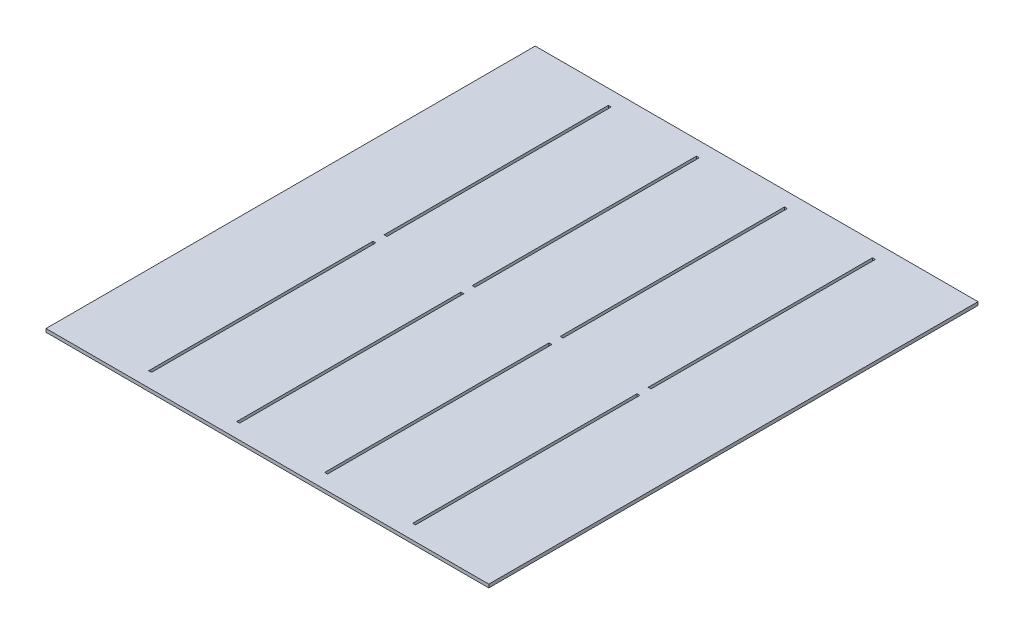
from build123d import *

# Parameters (mm, degrees)
SKETCH1_W          = 434.8
SKETCH1_H          = 480.4
SKETCH1_W_2        = 2.7888
SKETCH1_H_2        = 220.2
BASE_FLANGE2_DEPTH = 3.264


# Sheet-metal steps are written as plain solids
with BuildPart() as part:
    # Sketch1 → Base-Flange2 (new body)
    with BuildSketch(Plane(origin=(0, 0, 0), x_dir=(1, 0, 0), z_dir=(0, 1, 0))):
        with Locations((217.4, 240.2)):
            Rectangle(SKETCH1_W, SKETCH1_H)
        with Locations((87.74, 355.8112)):
            Rectangle(SKETCH1_W_2, SKETCH1_H_2, mode=Mode.SUBTRACT)
        with Locations((87.74, 124.5888)):
            Rectangle(SKETCH1_W_2, SKETCH1_H_2, mode=Mode.SUBTRACT)
        with Locations((174.18, 355.8112)):
            Rectangle(SKETCH1_W_2, SKETCH1_H_2, mode=Mode.SUBTRACT)
        with Locations((174.18, 124.5888)):
            Rectangle(SKETCH1_W_2, SKETCH1_H_2, mode=Mode.SUBTRACT)
        with Locations((260.62, 355.8112)):
            Rectangle(SKETCH1_W_2, SKETCH1_H_2, mode=Mode.SUBTRACT)
        with Locations((260.62, 124.5888)):
            Rectangle(SKETCH1_W_2, SKETCH1_H_2, mode=Mode.SUBTRACT)
        with Locations((347.06, 355.8112)):
            Rectangle(SKETCH1_W_2, SKETCH1_H_2, mode=Mode.SUBTRACT)
        with Locations((347.06, 124.5888)):
            Rectangle(SKETCH1_W_2, SKETCH1_H_2, mode=Mode.SUBTRACT)
    extrude(amount=-BASE_FLANGE2_DEPTH)


solid = part.part
